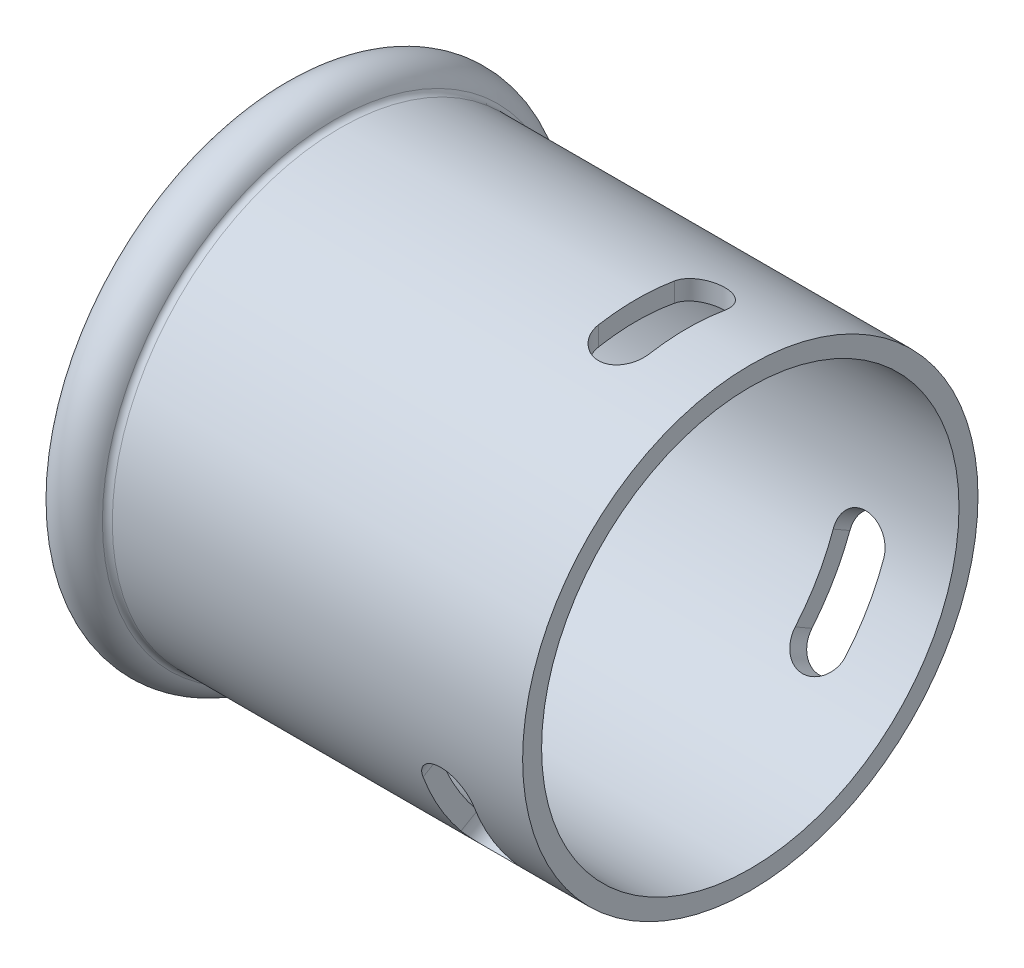
from build123d import *

# Parameters (mm, degrees)
ENL_V_MAT_EXTRU_1_DEPTH      = 20
R_P_TITION_CIRCULAIRE1_COUNT = 3


with BuildPart() as part:
    # Esquisse1 → Base-Révolution (revolve)
    with BuildSketch(Plane.XY):
        with BuildLine():
            Line((6.945704467, 17.5), (6.945704467, 17))
            Line((6.945704467, 17), (5.445704467, 17))
            Line((5.445704467, 17), (5.445704467, 17.5))
            ThreePointArc((5.445704467, 17.5), (7.279427039, 19.711156508), (9.791671669, 18.318181818))
            ThreePointArc((9.791671669, 18.318181818), (9.975404121, 18.087138588), (10.257442159, 18))
            Line((10.257442159, 18), (42.695704467, 18))
            Line((42.695704467, 18), (42.695704467, 16.5))
            Line((42.695704467, 16.5), (8.841348391, 16.5))
            ThreePointArc((8.841348391, 16.5), (8.423018378, 16.726138721), (8.383090822, 17.2))
            ThreePointArc((8.383090822, 17.2), (7.8489367, 18.234179735), (6.945704467, 17.5))
        make_face()
    revolve(axis=Axis((10.659710849, 0, 0), (1, 0, 0)))

    # Esquisse2 → Enlèv. mat.-Extru.1 (cut)
    with BuildSketch(Plane(origin=(0, 0, 0), x_dir=(1, 0, 0), z_dir=(0, 1, 0))):
        with BuildLine():
            Line((33.695704467, -3), (33.695704467, 3))
            ThreePointArc((33.695704467, 3), (35.695704467, 5), (37.695704467, 3))
            Line((37.695704467, 3), (37.695704467, -3))
            ThreePointArc((37.695704467, -3), (35.695704467, -5), (33.695704467, -3))
        make_face()
    enl_v_mat_extru_1 = extrude(amount=ENL_V_MAT_EXTRU_1_DEPTH, mode=Mode.SUBTRACT)

    # Répétition circulaire1: Enlèv. mat.-Extru.1 ×3 about axis
    r_p_tition_circulaire1_axis = Axis((10.659710849, 0, 0), (1, 0, 0))
    for i in range(1, R_P_TITION_CIRCULAIRE1_COUNT):
        add(enl_v_mat_extru_1.rotate(r_p_tition_circulaire1_axis, i * 360 / R_P_TITION_CIRCULAIRE1_COUNT), mode=Mode.SUBTRACT)


solid = part.part
